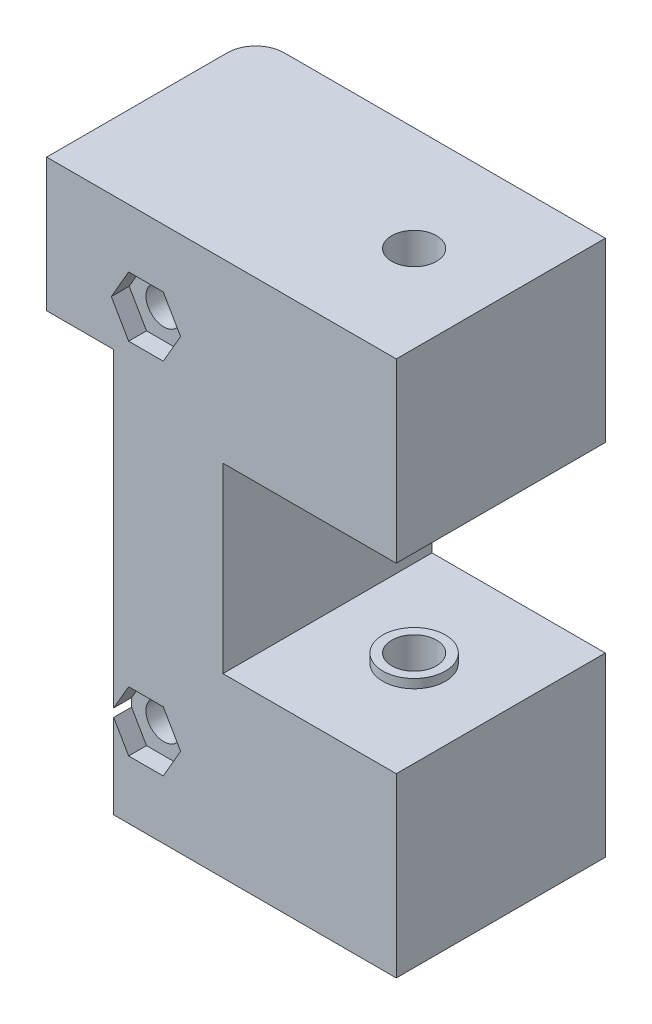
from build123d import *

# Parameters (mm, degrees)
MAINBLOCK_R                     = 2
MAINBLOCKBOSS_EXTRUDE1_DEPTH    = 23.4
TOPHOLECUT_SKETCH2_R            = 2.5
TOPHOLECUT_EXTRUDE1_DEPTH       = 45
MOUNTHOLEBORECUT_EXTRUDE2_DEPTH = 2
TOPSPACERSKETCH4_R              = 3.5
TOPSPACERSKETCH4_R_2            = 2.5
TOPSPACERBOSS_EXTRUDE2_DEPTH    = 1
LOWERSPACERBOSS_EXTRUDE3_START  = 1
LOWERSPACERSKETCH5_R            = 3.5
LOWERSPACERSKETCH5_R_2          = 2.5
LOWERSPACERBOSS_EXTRUDE3_DEPTH  = 1
PUSHPINHOLESKETCH1_R            = 1
PUSHPINHOLECUT_EXTRUDE1_DEPTH   = 76.354665582
MIDRAILINDENTSKETCH1_W          = 7.5
MIDRAILINDENTSKETCH1_H          = 45.1
MIDRAILINDENTCUT_EXTRUDE1_DEPTH = 76.354665582
VERTICALSUPPORTFILLET1_R        = 3.175


with BuildPart() as part:
    # MainBlock → MainBlockBoss-Extrude1 (new body)
    with BuildSketch(Plane.XY):
        Polygon((0, 0), (39.125, 0), (39.125, 19.8), (19.725, 19.8), (19.725, 40.2), (39.125, 40.2), (39.125, 60), (0, 60), align=None)
        with Locations((11.1125, 50.1)):
            Circle(MAINBLOCK_R, mode=Mode.SUBTRACT)
        with Locations((11.1125, 9.9)):
            Circle(MAINBLOCK_R, mode=Mode.SUBTRACT)
    extrude(amount=MAINBLOCKBOSS_EXTRUDE1_DEPTH)

    # TopHoleCut-Sketch2 → TopHoleCut-Extrude1 (cut)
    with BuildSketch(Plane(origin=(0, 60, 0), x_dir=(1, 0, 0), z_dir=(0, 1, 0))):
        with Locations((29.425, -11.7)):
            Circle(TOPHOLECUT_SKETCH2_R)
    extrude(amount=-TOPHOLECUT_EXTRUDE1_DEPTH, mode=Mode.SUBTRACT)

    # MountHoleBoreSketch3 → MountHoleBoreCut-Extrude2 (cut)
    with BuildSketch(Plane.XY.offset(23.4)):
        Polygon((14.9875, 50.1), (13.05, 53.45584844), (9.175, 53.45584844), (7.2375, 50.1), (9.175, 46.74415156), (13.05, 46.74415156), align=None)
        Polygon((14.9875, 9.9), (13.05, 13.25584844), (9.175, 13.25584844), (7.2375, 9.9), (9.175, 6.54415156), (13.05, 6.54415156), align=None)
    extrude(amount=-MOUNTHOLEBORECUT_EXTRUDE2_DEPTH, mode=Mode.SUBTRACT)

    # TopSpacerSketch4 → TopSpacerBoss-Extrude2 (add)
    with BuildSketch(Plane.XZ.offset(-40.2)):
        with Locations((29.425, 11.7)):
            Circle(TOPSPACERSKETCH4_R)
        with Locations((29.425, 11.7)):
            Circle(TOPSPACERSKETCH4_R_2, mode=Mode.SUBTRACT)
    extrude(amount=TOPSPACERBOSS_EXTRUDE2_DEPTH)

    # LowerSpacerSketch5 → LowerSpacerBoss-Extrude3 (add)
    with BuildSketch(Plane(origin=(0, 19.8, 0), x_dir=(1, 0, 0), z_dir=(0, 1, 0)).offset(LOWERSPACERBOSS_EXTRUDE3_START)):
        with Locations((29.425, -11.7)):
            Circle(LOWERSPACERSKETCH5_R)
        with Locations((29.425, -11.7)):
            Circle(LOWERSPACERSKETCH5_R_2, mode=Mode.SUBTRACT)
    extrude(amount=-LOWERSPACERBOSS_EXTRUDE3_DEPTH)

    # PushPinHoleSketch1 → PushPinHoleCut-Extrude1 (cut, through all)
    with BuildSketch(Plane.XZ):
        with Locations((29.425, 11.7)):
            Circle(PUSHPINHOLESKETCH1_R)
    extrude(amount=-PUSHPINHOLECUT_EXTRUDE1_DEPTH, mode=Mode.SUBTRACT)

    # MidRailIndentSketch1 → MidRailIndentCut-Extrude1 (cut, through all)
    with BuildSketch(Plane.XY.offset(23.4)):
        with Locations((3.75, 22.55)):
            Rectangle(MIDRAILINDENTSKETCH1_W, MIDRAILINDENTSKETCH1_H)
    extrude(amount=-MIDRAILINDENTCUT_EXTRUDE1_DEPTH, mode=Mode.SUBTRACT)

    # VerticalSupportFillet1
    verticalsupportfillet1_edges = [part.edges().sort_by_distance(p)[0] for p in [
        (0, 52.55, 0),
    ]]
    fillet(verticalsupportfillet1_edges, radius=VERTICALSUPPORTFILLET1_R)


solid = part.part
